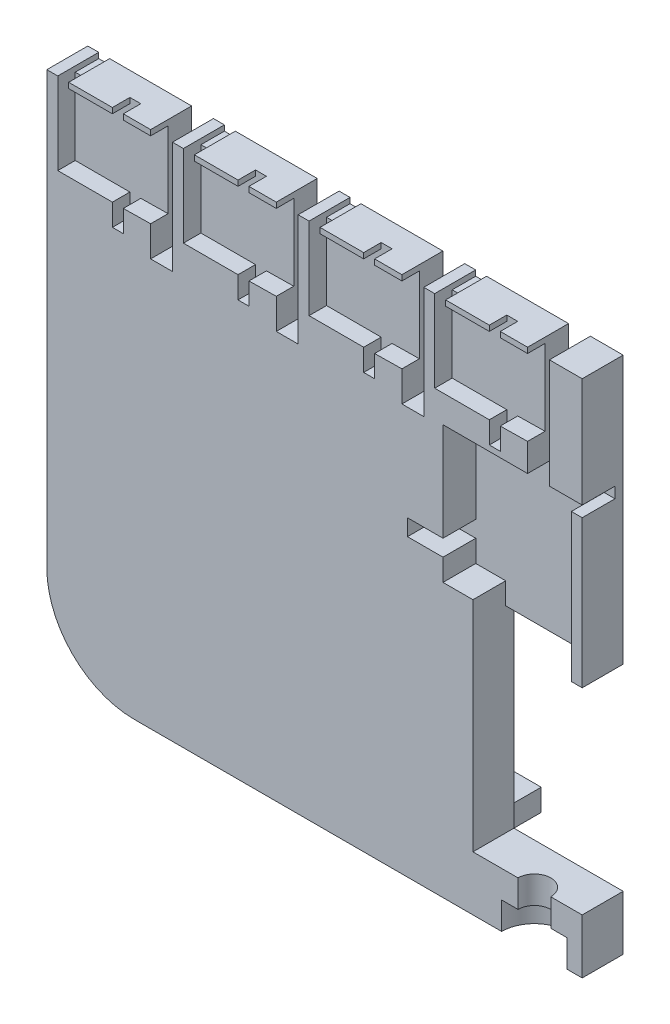
from build123d import *

# Parameters (mm, degrees)
BOSS_EXTRUDE1_DEPTH = 7.5
SKETCH38_W          = 4
SKETCH38_H          = 7.5
CUT_EXTRUDE28_DEPTH = 20.5
CUT_EXTRUDE1_DEPTH  = 3.2
CUT_EXTRUDE32_DEPTH = 6
CUT_EXTRUDE33_DEPTH = 5
CUT_EXTRUDE34_REACH = 104.748
CUT_EXTRUDE35_REACH = 70.655
SKETCH43_W          = 2
SKETCH43_H          = 1.000000225
SKETCH44_W          = 50
SKETCH44_H          = 4
BOSS_EXTRUDE5_DEPTH = 15
CUT_EXTRUDE36_REACH = 106.437
SKETCH45_R          = 3.5


with BuildPart() as part:
    # Sketch1 → Boss-Extrude1 (new body)
    with BuildSketch(Plane.XY):
        with BuildLine():
            Line((-33, -47.5), (49, -47.5))
            Line((49, -47.5), (49, -37.5))
            Line((49, -37.5), (29, -37.5))
            Line((29, -37.5), (29, -1.5))
            Line((29, -1.5), (49, -1.5))
            Line((49, -1.5), (49, 47.5))
            Line((49, 47.5), (30, 47.5))
            Line((30, 47.5), (27, 47.5))
            Line((27, 47.5), (-49, 47.5))
            Line((-49, 47.5), (-49, -31.5))
            ThreePointArc((-49, -31.5), (-44.313708499, -42.813708499), (-33, -47.5))
        make_face()
    extrude(amount=BOSS_EXTRUDE1_DEPTH)

    # Sketch38 → Cut-Extrude28 (cut)
    with BuildSketch(Plane(origin=(0, 47.5, 0), x_dir=(1, 0, 0), z_dir=(0, 1, 0))):
        with Locations((-28, -3.75)):
            Rectangle(SKETCH38_W, SKETCH38_H)
        with Locations((-5, -3.75)):
            Rectangle(SKETCH38_W, SKETCH38_H)
        with Locations((18, -3.75)):
            Rectangle(SKETCH38_W, SKETCH38_H)
        with Locations((41, -3.75)):
            Rectangle(SKETCH38_W, SKETCH38_H)
    extrude(amount=-CUT_EXTRUDE28_DEPTH, mode=Mode.SUBTRACT)

    # Sketch2 → Cut-Extrude1 (cut)
    with BuildSketch(Plane.XY.offset(7.5)):
        Polygon((-30, 45.071597386), (-30, 40.071597386), (-30, 32.571597386), (-34.999487352, 32.499999775), (-34.999487352, 28.499999775), (-37.000829904, 28.499999775), (-37.000829904, 32.499999775), (-47, 32.499999775), (-47, 46.499999775), (-37.000829904, 46.499999775), (-37.000829904, 47.5), (-34.999487352, 47.5), (-34.999487352, 46.499999775), (-30, 46.499999775), align=None)
        Polygon((-24, 32.499999775), (-24, 46.499999775), (-14.000829904, 46.499999775), (-14.000829904, 47.5), (-11.999487352, 47.5), (-11.999487352, 46.499999775), (-7, 46.499999775), (-7, 45.071597386), (-7, 40.071597386), (-7, 32.571597386), (-11.999487352, 32.499999775), (-11.999487352, 28.499999775), (-14.000829904, 28.499999775), (-14.000829904, 32.499999775), align=None)
        Polygon((-1, 32.499999775), (-1, 46.499999775), (8.999170096, 46.499999775), (8.999170096, 47.5), (11.000512648, 47.5), (11.000512648, 46.499999775), (16, 46.499999775), (16, 45.071597386), (16, 40.071597386), (16, 32.571597386), (11.000512648, 32.499999775), (11.000512648, 28.499999775), (8.999170096, 28.499999775), (8.999170096, 32.499999775), align=None)
        Polygon((22, 32.499999775), (22, 46.499999775), (31.999170096, 46.499999775), (31.999170096, 47.5), (34.000512648, 47.5), (34.000512648, 46.499999775), (39, 46.499999775), (39, 45.071597386), (39, 40.071597386), (39, 32.571597386), (34.000512648, 32.499999775), (34.000512648, 28.499999775), (31.999170096, 28.499999775), (31.999170096, 32.499999775), align=None)
    extrude(amount=-CUT_EXTRUDE1_DEPTH, mode=Mode.SUBTRACT)

    # Sketch40 → Cut-Extrude32 (cut)
    with BuildSketch(Plane.XY.offset(7.5)):
        Polygon((23.517755982, 6.474096155), (23.517755982, 2.474096155), (29, 2.474096155), (29, -1.5), (47.017755982, -1.5), (47.017755982, 2.474096155), (47.017755982, 25.474096155), (49, 25.474096155), (49, 27.474096155), (47.017755982, 27.474096155), (23.517755982, 27.474096155), (23.517755982, 9.474096155), (17.017755982, 9.474096155), (17.017755982, 6.474096155), align=None)
    extrude(amount=-CUT_EXTRUDE32_DEPTH, mode=Mode.SUBTRACT)

    # Sketch41 → Cut-Extrude33 (cut)
    with BuildSketch(Plane.XZ.offset(47.5)):
        with BuildLine():
            Line((34.25, 7.5), (46.25, 7.5))
            ThreePointArc((46.25, 7.5), (40.25, 1.5), (34.25, 7.5))
        make_face()
    extrude(amount=-CUT_EXTRUDE33_DEPTH, mode=Mode.SUBTRACT)

    # Sketch42 → Cut-Extrude34 (cut, up to next)
    with BuildSketch(Plane.XZ.offset(42.5), mode=Mode.PRIVATE) as cut_extrude34_sk1:
        with BuildLine():
            Line((37.25, 7.5), (43.25, 7.5))
            ThreePointArc((43.25, 7.5), (40.25, 4.5), (37.25, 7.5))
        make_face()
    cut_extrude34_tool1 = extrude(cut_extrude34_sk1.sketch, amount=-CUT_EXTRUDE34_REACH, mode=Mode.PRIVATE) & part.part
    add(cut_extrude34_tool1.solids().sort_by_distance((40.25, -42.5, 6.22676))[0], mode=Mode.SUBTRACT)

    # Sketch43 → Cut-Extrude35 (cut, up to next)
    with BuildSketch(Plane.XY.offset(7.5), mode=Mode.PRIVATE) as cut_extrude35_sk1:
        with Locations((-46, 46.999999888)):
            Rectangle(SKETCH43_W, SKETCH43_H)
    cut_extrude35_tool1 = extrude(cut_extrude35_sk1.sketch, amount=-CUT_EXTRUDE35_REACH, mode=Mode.PRIVATE) & part.part
    # Sketch43 → Cut-Extrude35 (cut, up to next)
    with BuildSketch(Plane.XY.offset(7.5), mode=Mode.PRIVATE) as cut_extrude35_sk2:
        with Locations((-23, 46.999999888)):
            Rectangle(SKETCH43_W, SKETCH43_H)
    cut_extrude35_tool2 = extrude(cut_extrude35_sk2.sketch, amount=-CUT_EXTRUDE35_REACH, mode=Mode.PRIVATE) & part.part
    # Sketch43 → Cut-Extrude35 (cut, up to next)
    with BuildSketch(Plane.XY.offset(7.5), mode=Mode.PRIVATE) as cut_extrude35_sk3:
        with Locations((0, 46.999999888)):
            Rectangle(SKETCH43_W, SKETCH43_H)
    cut_extrude35_tool3 = extrude(cut_extrude35_sk3.sketch, amount=-CUT_EXTRUDE35_REACH, mode=Mode.PRIVATE) & part.part
    # Sketch43 → Cut-Extrude35 (cut, up to next)
    with BuildSketch(Plane.XY.offset(7.5), mode=Mode.PRIVATE) as cut_extrude35_sk4:
        with Locations((23, 46.999999888)):
            Rectangle(SKETCH43_W, SKETCH43_H)
    cut_extrude35_tool4 = extrude(cut_extrude35_sk4.sketch, amount=-CUT_EXTRUDE35_REACH, mode=Mode.PRIVATE) & part.part
    add(cut_extrude35_tool1.solids().sort_by_distance((-46, 47, 7.5))[0], mode=Mode.SUBTRACT)
    add(cut_extrude35_tool2.solids().sort_by_distance((-23, 47, 7.5))[0], mode=Mode.SUBTRACT)
    add(cut_extrude35_tool3.solids().sort_by_distance((0, 47, 7.5))[0], mode=Mode.SUBTRACT)
    add(cut_extrude35_tool4.solids().sort_by_distance((23, 47, 7.5))[0], mode=Mode.SUBTRACT)

    # Sketch44 → Boss-Extrude5 (add)
    with BuildSketch(Plane(origin=(0, 0, 0), x_dir=(-1, 0, 0), z_dir=(0, 0, -1))):
        with Locations((6, -45.5)):
            Rectangle(SKETCH44_W, SKETCH44_H)
    extrude(amount=BOSS_EXTRUDE5_DEPTH)

    # Sketch45 → Cut-Extrude36 (cut, up to next)
    with BuildSketch(Plane(origin=(0, -43.5, 0), x_dir=(1, 0, 0), z_dir=(0, 1, 0)), mode=Mode.PRIVATE) as cut_extrude36_sk1:
        with Locations((1, 7.5)):
            Circle(SKETCH45_R)
    cut_extrude36_tool1 = extrude(cut_extrude36_sk1.sketch, amount=-CUT_EXTRUDE36_REACH, mode=Mode.PRIVATE) & part.part
    add(cut_extrude36_tool1.solids().sort_by_distance((1, -43.5, -7.5))[0], mode=Mode.SUBTRACT)


solid = part.part
